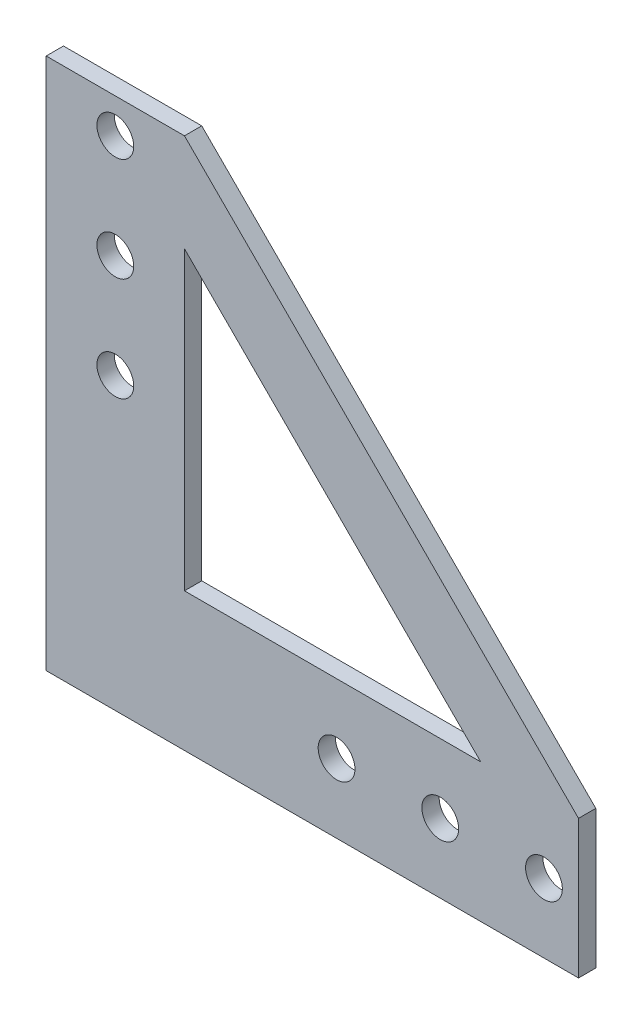
from build123d import *

# Parameters (mm, degrees)
BOSS_EXTRUDE1_DEPTH = 3.175
SKETCH2_R           = 3.3782
CUT_EXTRUDE1_DEPTH  = 139.332385308


with BuildPart() as part:
    # Sketch1 → Boss-Extrude1 (new body)
    with BuildSketch(Plane.XY):
        Polygon((97.79, 25.4), (25.4, 97.79), (0, 97.79), (0, 25.4), (0, 0), (25.4, 0), (97.79, 0), align=None)
        Polygon((79.829487758, 25.4), (25.4, 25.4), (25.4, 79.829487758), align=None, mode=Mode.SUBTRACT)
    extrude(amount=BOSS_EXTRUDE1_DEPTH)

    # Sketch2 → Cut-Extrude1 (cut, through all)
    with BuildSketch(Plane.XY.offset(3.175)):
        with Locations((53.34, 12.7)):
            Circle(SKETCH2_R)
        with Locations((72.39, 12.7)):
            Circle(SKETCH2_R)
        with Locations((12.7, 53.34)):
            Circle(SKETCH2_R)
        with Locations((12.7, 72.39)):
            Circle(SKETCH2_R)
        with Locations((12.7, 91.44)):
            Circle(SKETCH2_R)
        with Locations((91.44, 12.7)):
            Circle(SKETCH2_R)
    extrude(amount=-CUT_EXTRUDE1_DEPTH, mode=Mode.SUBTRACT)


solid = part.part
